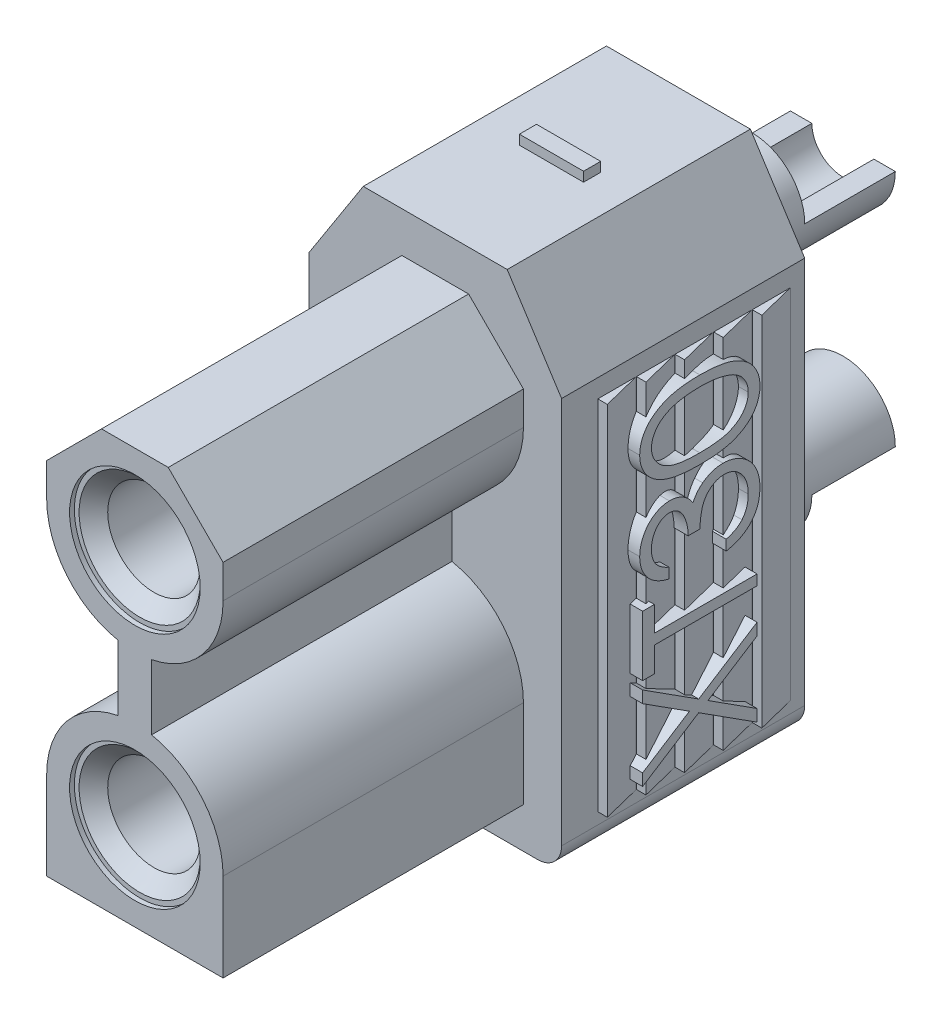
from build123d import *

# Parameters (mm, degrees)
BOSS_EXTRUDE2_DEPTH        = 5.1
BOSS_EXTRUDE3_START        = 1.45
BOSS_EXTRUDE3_DEPTH        = 3.65
BOSS_EXTRUDE4_START        = 1
BOSS_EXTRUDE4_DEPTH        = 7.5
BOSS_EXTRUDE5_DEPTH        = 5.1
BOSS_EXTRUDE5_DEPTH_BACK   = 3.45
SKETCH7_R                  = 1.1
BOSS_EXTRUDE5_2_DEPTH      = 5.1
BOSS_EXTRUDE5_2_DEPTH_BACK = 3.45
SKETCH8_R                  = 0.65
CUT_EXTRUDE1_DEPTH         = 3
CUT_EXTRUDE2_DEPTH         = 13.156309846
CUT_EXTRUDE2_DEPTH_BACK    = 13.156309846
SKETCH9_W                  = 1.9
SKETCH9_H                  = 1.1
SKETCH9_W_2                = 1.75
CHAMFER1_SIZE              = 0.65
CHAMFER3_SIZE              = 0.65
SKETCH10_R                 = 1.37
SKETCH10_R_2               = 0.97
BOSS_EXTRUDE6_DEPTH        = 6.2
BOSS_EXTRUDE6_2_DEPTH      = 6.2
BOSS_EXTRUDE7_DEPTH        = 0.2
SKETCH13_W                 = 1.346153847
SKETCH13_H                 = 0.358974359
BOSS_EXTRUDE8_DEPTH        = 0.2
BOSS_EXTRUDE9_DEPTH        = 0.3
BOSS_EXTRUDE10_DEPTH       = 0.3
CHAMFER4_SIZE              = 0.3
CHAMFER5_SIZE              = 0.3
SKETCH17_R                 = 1.37
BOSS_EXTRUDE11_DEPTH       = 6.3
BOSS_EXTRUDE11_2_DEPTH     = 6.3
SKETCH18_W                 = 0.7
SKETCH18_H                 = 1.720139453
BOSS_EXTRUDE12_DEPTH       = 6.3


with BuildPart() as part:
    # Sketch3 → Boss-Extrude2 (new body)
    with BuildSketch(Plane.XY):
        with BuildLine():
            Line((2.15, 0.260364397), (-2.15, 0.260364397))
            ThreePointArc((-2.15, 0.260364397), (-2.503553391, 0.406811006), (-2.65, 0.760364397))
            Line((-2.65, 0.760364397), (-2.65, 8.886196367))
            Line((-2.65, 8.886196367), (-1.509463409, 10.660364397))
            Line((-1.509463409, 10.660364397), (1.509463409, 10.660364397))
            Line((1.509463409, 10.660364397), (2.65, 8.886196367))
            Line((2.65, 8.886196367), (2.65, 0.760364397))
            ThreePointArc((2.65, 0.760364397), (2.503553391, 0.406811006), (2.15, 0.260364397))
        make_face()
        Polygon((1.9, 1.010364397), (-1.9, 1.010364397), (-1.9, 8.665919952), (-1.1, 9.910364397), (1.1, 9.910364397), (1.9, 8.665919952), align=None, mode=Mode.SUBTRACT)
    extrude(amount=BOSS_EXTRUDE2_DEPTH)

    # Sketch4 → Boss-Extrude3 (add)
    with BuildSketch(Plane.XY.offset(BOSS_EXTRUDE3_START)):
        with BuildLine():
            Line((-1.5, 10.010364397), (1.4, 10.010364397))
            ThreePointArc((1.4, 10.010364397), (1.753553391, 9.863917787), (1.9, 9.510364397))
            Line((1.9, 9.510364397), (1.9, 1.010364397))
            Line((1.9, 1.010364397), (-2, 1.010364397))
            Line((-2, 1.010364397), (-2, 9.510364397))
            ThreePointArc((-2, 9.510364397), (-1.853553391, 9.863917787), (-1.5, 10.010364397))
        make_face()
    extrude(amount=BOSS_EXTRUDE3_DEPTH)

    # Sketch6 → Boss-Extrude4 (add)
    with BuildSketch(Plane(origin=(0, 0, 0), x_dir=(1, 0, 0), z_dir=(0, 1, 0)).offset(BOSS_EXTRUDE4_START)):
        Polygon((2.65, -0.3), (2.65, -1.1), (2.85, -1.1), align=None)
        Polygon((2.65, -1.11), (2.65, -1.91), (2.85, -1.91), align=None)
        Polygon((2.65, -1.92), (2.65, -2.72), (2.85, -2.72), align=None)
        Polygon((2.65, -2.73), (2.65, -3.53), (2.85, -3.53), align=None)
        Polygon((2.65, -3.54), (2.65, -4.34), (2.85, -4.34), align=None)
        Polygon((-2.85, -4.34), (-2.65, -3.54), (-2.65, -4.34), align=None)
        Polygon((-2.85, -3.53), (-2.65, -2.73), (-2.65, -3.53), align=None)
        Polygon((-2.85, -2.72), (-2.65, -1.92), (-2.65, -2.72), align=None)
        Polygon((-2.85, -1.91), (-2.65, -1.11), (-2.65, -1.91), align=None)
        Polygon((-2.85, -1.1), (-2.65, -0.3), (-2.65, -1.1), align=None)
    extrude(amount=BOSS_EXTRUDE4_DEPTH)

    # Sketch12 → Boss-Extrude7 (add)
    with BuildSketch(Plane.XZ.offset(-0.260364397)):
        Polygon((-0.148717949, 2.884615385), (-0.148717949, 3.916666667), (0.165384615, 3.916666667), (0.165384615, 2.884615385), (1.197435897, 2.884615385), (1.197435897, 2.570512821), (0.165384615, 2.570512821), (0.165384615, 1.538461538), (-0.148717949, 1.538461538), (-0.148717949, 2.570512821), (-1.180769231, 2.570512821), (-1.180769231, 2.884615385), align=None)
    extrude(amount=BOSS_EXTRUDE7_DEPTH)

    # Sketch13 → Boss-Extrude8 (add)
    with BuildSketch(Plane(origin=(0, 10.660364397, 0), x_dir=(-1, 0, 0), z_dir=(0, 1, 0))):
        with Locations((-0.052168047, 2.534824587)):
            Rectangle(SKETCH13_W, SKETCH13_H)
    extrude(amount=BOSS_EXTRUDE8_DEPTH)

    # Sketch14 → Boss-Extrude9 (add)
    # profile 1 of 4: a face of its own
    with BuildSketch(Plane.ZY.offset(2.65)):
        Polygon((3.7, 8.211538462), (3.7, 7.962980769), (2.718269231, 7.334615385), (3.7, 6.70625), (3.7, 6.457692308), (2.524038462, 7.210096154), (1.3, 6.426923077), (1.3, 6.675480769), (2.329807692, 7.334615385), (1.3, 7.99375), (1.3, 8.242307692), (2.524038462, 7.458653846), align=None)
    # profile 2 of 4: a face of its own
    with BuildSketch(Plane.ZY.offset(2.65)):
        Polygon((3.453846154, 6.288461538), (3.7, 6.288461538), (3.7, 5.026923077), (3.453846154, 5.026923077), (3.453846154, 5.55), (1.3, 5.55), (1.3, 5.765384615), (3.453846154, 5.765384615), align=None)
    # profile 3 of 4: a face of its own
    with BuildSketch(Plane.ZY.offset(2.65)):
        with BuildLine():
            Line((3.146153846, 4.503846154), (3.146153846, 4.719230769))
            add(Edge.make_bspline(
                [(3.146153846, 4.719230769), (3.170313264, 4.713395649), (3.217542949, 4.701988466), (3.285022214, 4.678195844), (3.348878343, 4.652276354), (3.40791565, 4.621152397), (3.463320612, 4.587203537), (3.513836583, 4.548307957), (3.560748331, 4.506260147), (3.602380265, 4.45975161), (3.64007928, 4.410977671), (3.672222176, 4.359251074), (3.699873024, 4.305612519), (3.722652611, 4.24969037), (3.73981297, 4.191318138), (3.752263351, 4.131023539), (3.760348687, 4.068648568), (3.761137781, 4.026307363), (3.761538462, 4.004807692)],
                knots=[0, 0, 0, 0, 1.162005537, 2.271625781, 3.343758855, 4.383309926, 5.390229558, 6.379919256, 7.361854164, 8.333198761, 9.295911338, 10.242430842, 11.177959212, 12.116337295, 13.062827104, 14.020064771, 14.994644689, 16, 16, 16, 16], degree=3))
            add(Edge.make_bspline(
                [(3.761538462, 4.004807692), (3.760592704, 3.973482383), (3.758721818, 3.911515062), (3.741637633, 3.820477544), (3.714603256, 3.732687725), (3.677249843, 3.649106526), (3.631178543, 3.57147103), (3.57634558, 3.502394787), (3.513808916, 3.442814094), (3.444735158, 3.392829378), (3.370914237, 3.353692236), (3.294936987, 3.324833008), (3.216983635, 3.307263856), (3.164350072, 3.304986903), (3.137980769, 3.303846154)],
                knots=[0, 0, 0, 0, 1.083050992, 2.142477498, 3.193116406, 4.255571735, 5.30263384, 6.308962982, 7.297363603, 8.282367274, 9.249857812, 10.179914175, 11.08814088, 12, 12, 12, 12], degree=3))
            add(Edge.make_bspline(
                [(3.137980769, 3.303846154), (3.112604681, 3.304644045), (3.062947616, 3.306205394), (2.990452875, 3.319462792), (2.922127206, 3.341773372), (2.85768298, 3.372678352), (2.797528805, 3.412683987), (2.741529337, 3.461145264), (2.689436199, 3.518404233), (2.659594275, 3.561795504), (2.644230769, 3.584134615)],
                knots=[0, 0, 0, 0, 1.024540389, 2.004866551, 2.965041327, 3.920577974, 4.882998113, 5.874504559, 6.905732034, 8, 8, 8, 8], degree=3))
            add(Edge.make_bspline(
                [(2.644230769, 3.584134615), (2.63190288, 3.558604269), (2.607477766, 3.50802127), (2.559576676, 3.439072335), (2.504269466, 3.376481792), (2.46110879, 3.341576385), (2.439423077, 3.324038462)],
                knots=[0, 0, 0, 0, 1.015518401, 2.012035669, 3.001164323, 4, 4, 4, 4], degree=3))
            add(Edge.make_bspline(
                [(2.439423077, 3.324038462), (2.423613732, 3.312485412), (2.392253932, 3.289568501), (2.341804337, 3.261361383), (2.290962579, 3.235479451), (2.237729623, 3.216431099), (2.183815408, 3.199993125), (2.128065414, 3.189177486), (2.071009313, 3.182234278), (2.032392143, 3.18125931), (2.012980769, 3.180769231)],
                knots=[0, 0, 0, 0, 1.02516404, 2.033540309, 3.025129118, 4.011046665, 4.991655828, 5.976607087, 6.982917762, 8, 8, 8, 8], degree=3))
            add(Edge.make_bspline(
                [(2.012980769, 3.180769231), (1.97937544, 3.182002464), (1.912322928, 3.184463127), (1.813234502, 3.206368134), (1.716541423, 3.240522701), (1.623676369, 3.288177011), (1.536970145, 3.347137911), (1.45974361, 3.417672544), (1.39291464, 3.498066224), (1.33725751, 3.587792791), (1.292734208, 3.684961717), (1.261839895, 3.788901588), (1.241716319, 3.898100993), (1.239558549, 3.972986084), (1.238461538, 4.011057692)],
                knots=[0, 0, 0, 0, 0.95570045, 1.906903359, 2.87519758, 3.868912786, 4.869932978, 5.851730567, 6.836639976, 7.83677598, 8.849487602, 9.869908895, 10.917060885, 12, 12, 12, 12], degree=3))
            add(Edge.make_bspline(
                [(1.238461538, 4.011057692), (1.239056885, 4.036716641), (1.240228328, 4.087204896), (1.248236511, 4.161429009), (1.262862801, 4.232278174), (1.282545067, 4.299848184), (1.307499405, 4.364199066), (1.338575083, 4.425134453), (1.375131542, 4.483029237), (1.417600288, 4.537337089), (1.465107492, 4.588051536), (1.518496527, 4.633824832), (1.576780462, 4.675420119), (1.640636272, 4.711723643), (1.709238734, 4.744388981), (1.783466275, 4.771255923), (1.862655319, 4.79490317), (1.917840055, 4.805897546), (1.946153846, 4.811538462)],
                knots=[0, 0, 0, 0, 1.048658725, 2.063410685, 3.046034179, 4.001477787, 4.936774919, 5.862367409, 6.792675028, 7.730719943, 8.675894397, 9.627829632, 10.600096036, 11.597688215, 12.626045268, 13.701542398, 14.82072376, 16, 16, 16, 16], degree=3))
            Line((1.946153846, 4.811538462), (1.946153846, 4.596153846))
            add(Edge.make_bspline(
                [(1.946153846, 4.596153846), (1.927674523, 4.590542446), (1.891730634, 4.579627786), (1.840000138, 4.561048839), (1.792577473, 4.539882024), (1.749114761, 4.517174898), (1.709183971, 4.493326821), (1.673840975, 4.466642301), (1.641533408, 4.439097744), (1.623331388, 4.418334759), (1.614423077, 4.408173077)],
                knots=[0, 0, 0, 0, 1.198163088, 2.33053128, 3.407730985, 4.417276592, 5.372219308, 6.28897303, 7.162600585, 8, 8, 8, 8], degree=3))
            add(Edge.make_bspline(
                [(1.614423077, 4.408173077), (1.604063077, 4.394735424), (1.583375055, 4.367901598), (1.556973938, 4.324174811), (1.534097806, 4.278187461), (1.516623272, 4.228943113), (1.501827162, 4.177504413), (1.49214452, 4.123039934), (1.485501203, 4.066030185), (1.484914964, 4.027103719), (1.484615385, 4.007211538)],
                knots=[0, 0, 0, 0, 0.946170439, 1.889420265, 2.845303464, 3.807233317, 4.801018734, 5.828864929, 6.890507805, 8, 8, 8, 8], degree=3))
            add(Edge.make_bspline(
                [(1.484615385, 4.007211538), (1.485037033, 3.98475169), (1.485861529, 3.940833395), (1.493465896, 3.87675431), (1.504492464, 3.815774027), (1.521740161, 3.758514848), (1.542431622, 3.704197617), (1.569520542, 3.654034852), (1.600113099, 3.606551829), (1.635698125, 3.563139581), (1.674161687, 3.524001317), (1.714968099, 3.490181532), (1.756852096, 3.460889731), (1.800790747, 3.437344011), (1.846353049, 3.418718241), (1.893709543, 3.406046248), (1.942461457, 3.397233195), (1.975601388, 3.396515597), (1.992307692, 3.396153846)],
                knots=[0, 0, 0, 0, 1.216990249, 2.379719373, 3.493992396, 4.571561497, 5.616923107, 6.638958652, 7.655775068, 8.674704564, 9.676001865, 10.625896028, 11.54399481, 12.441854662, 13.322657739, 14.20572845, 15.095482574, 16, 16, 16, 16], degree=3))
            add(Edge.make_bspline(
                [(1.992307692, 3.396153846), (2.014669779, 3.397203177), (2.05928268, 3.399296618), (2.12491721, 3.415279923), (2.188157598, 3.441568341), (2.247915784, 3.478376614), (2.303327092, 3.523161948), (2.352574163, 3.575490823), (2.393618756, 3.635491603), (2.421872315, 3.691070581), (2.440702124, 3.740419384), (2.453905233, 3.782567182), (2.464459565, 3.829794668), (2.474668782, 3.881534884), (2.483227542, 3.938006046), (2.490395838, 3.99925903), (2.496122592, 4.065318479), (2.498681403, 4.111049473), (2.5, 4.134615385)],
                knots=[0, 0, 0, 0, 1.070481957, 2.135637345, 3.216366529, 4.339485895, 5.485746587, 6.620975969, 7.768829582, 8.956804399, 9.598399438, 10.297751078, 11.070570279, 11.915248466, 12.824061284, 13.805856426, 14.869322739, 16, 16, 16, 16], degree=3))
            Line((2.5, 4.134615385), (2.746153846, 4.134615385))
            add(Edge.make_bspline(
                [(2.746153846, 4.134615385), (2.746659909, 4.104923977), (2.74765116, 4.046765804), (2.759557156, 3.961798157), (2.776212077, 3.880451678), (2.801133952, 3.804583191), (2.831047314, 3.735657242), (2.864776815, 3.675530146), (2.902990827, 3.62562689), (2.945187826, 3.585822797), (2.990973089, 3.556608006), (3.038193773, 3.534679412), (3.087948546, 3.521823981), (3.121884535, 3.520098217), (3.138942308, 3.519230769)],
                knots=[0, 0, 0, 0, 1.321708579, 2.588902423, 3.815526512, 5.016621128, 6.138757764, 7.158873101, 8.079948563, 8.928590313, 9.728601868, 10.489025425, 11.240515403, 12, 12, 12, 12], degree=3))
            add(Edge.make_bspline(
                [(3.138942308, 3.519230769), (3.151475649, 3.519514904), (3.176410136, 3.520080176), (3.212838313, 3.527210223), (3.248154898, 3.537922039), (3.282199645, 3.552657938), (3.314774944, 3.572345731), (3.345920757, 3.59597764), (3.376159056, 3.623565073), (3.404043204, 3.655829025), (3.430345097, 3.690758195), (3.453082104, 3.728681243), (3.472353977, 3.768761731), (3.488276651, 3.811036515), (3.500246646, 3.855674947), (3.508843236, 3.902458453), (3.514217465, 3.951478695), (3.514991259, 3.984922153), (3.515384615, 4.001923077)],
                knots=[0, 0, 0, 0, 0.884317272, 1.759307272, 2.611736065, 3.488921043, 4.37244062, 5.294096728, 6.247679003, 7.258495569, 8.302441962, 9.333537773, 10.376747089, 11.440883505, 12.520330301, 13.637364711, 14.798958396, 16, 16, 16, 16], degree=3))
            add(Edge.make_bspline(
                [(3.515384615, 4.001923077), (3.514432389, 4.029250838), (3.51257247, 4.082628311), (3.496224619, 4.159563101), (3.470323134, 4.231010572), (3.439047168, 4.285439132), (3.408279997, 4.325699299), (3.381810999, 4.355020423), (3.351800577, 4.383288989), (3.317425578, 4.409395714), (3.27986802, 4.434904968), (3.238921049, 4.459573177), (3.194000885, 4.482607996), (3.162411731, 4.496629667), (3.146153846, 4.503846154)],
                knots=[0, 0, 0, 0, 1.4727372, 2.876598283, 4.222346151, 5.558423782, 6.24313385, 6.953189256, 7.68715613, 8.463578749, 9.278833271, 10.135787152, 11.040551781, 12, 12, 12, 12], degree=3))
        make_face()
    # profile 4 of 4: a face of its own
    with BuildSketch(Plane.ZY.offset(2.65)):
        with BuildLine():
            add(Edge.make_bspline(
                [(2.499038462, 2.965384615), (2.537505242, 2.965159689), (2.612227517, 2.964722765), (2.721108414, 2.959862134), (2.823252613, 2.951787614), (2.918664999, 2.940721985), (3.007370214, 2.927255947), (3.089131173, 2.909279594), (3.164326392, 2.888836595), (3.233200736, 2.865143267), (3.296683291, 2.838409551), (3.355943811, 2.809309064), (3.410907058, 2.776702805), (3.462398728, 2.742398603), (3.509844149, 2.705142892), (3.553153471, 2.665328627), (3.592352846, 2.622560867), (3.627908811, 2.577685461), (3.658882589, 2.530418809), (3.686792023, 2.482217984), (3.709699001, 2.432232443), (3.728521186, 2.380918072), (3.743602926, 2.328424096), (3.754047002, 2.274533615), (3.760592629, 2.219233611), (3.761220193, 2.181909617), (3.761538462, 2.162980769)],
                knots=[0, 0, 0, 0, 1.646377244, 3.198111528, 4.663803227, 6.031090796, 7.308794487, 8.502186765, 9.612154809, 10.642545331, 11.617106989, 12.558866172, 13.465886467, 14.35053239, 15.20542558, 16.045215227, 16.865619885, 17.686225247, 18.492864914, 19.282407821, 20.068097601, 20.842842034, 21.620163247, 22.403093475, 23.190129512, 24, 24, 24, 24], degree=3))
            add(Edge.make_bspline(
                [(3.761538462, 2.162980769), (3.76120396, 2.143893584), (3.760538741, 2.105935178), (3.75414518, 2.049816063), (3.74353641, 1.994993425), (3.728504885, 1.941700987), (3.709856421, 1.889500996), (3.686482397, 1.838801745), (3.659274031, 1.789288317), (3.627303373, 1.741747549), (3.591658383, 1.695657527), (3.551363982, 1.652150352), (3.506827031, 1.611222065), (3.458524039, 1.572358998), (3.405528552, 1.536663732), (3.348762306, 1.502670521), (3.28723257, 1.472243982), (3.221965963, 1.442940205), (3.151156597, 1.417646271), (3.075203618, 1.394835131), (2.99320989, 1.376403839), (2.905605608, 1.361051195), (2.812069048, 1.349157552), (2.712800717, 1.340495169), (2.607735307, 1.335919339), (2.535901353, 1.335057601), (2.499038462, 1.334615385)],
                knots=[0, 0, 0, 0, 0.810914788, 1.612654377, 2.396697861, 3.181598691, 3.963628158, 4.749916497, 5.551656086, 6.361998678, 7.18212741, 8.025565596, 8.878627764, 9.750805457, 10.657531673, 11.591944965, 12.560506719, 13.57287815, 14.630710178, 15.753379473, 16.941251878, 18.199788006, 19.531962791, 20.947069417, 22.433333509, 24, 24, 24, 24], degree=3))
            add(Edge.make_bspline(
                [(2.499038462, 1.334615385), (2.46233649, 1.335062738), (2.390824197, 1.335934387), (2.286229632, 1.340437871), (2.187494777, 1.349350593), (2.094344793, 1.360374224), (2.00733274, 1.376077235), (1.925631239, 1.393928791), (1.849945361, 1.416116359), (1.779509438, 1.441065535), (1.714562595, 1.46973345), (1.653564755, 1.500428903), (1.596844827, 1.534213456), (1.543850111, 1.570121601), (1.495128206, 1.608654337), (1.450558698, 1.649755931), (1.410170985, 1.69345767), (1.374038974, 1.739651897), (1.342440476, 1.787940548), (1.314196501, 1.837288706), (1.291278267, 1.888681315), (1.271927958, 1.940976215), (1.256861852, 1.994666843), (1.246546191, 2.049700536), (1.239291373, 2.105897061), (1.238739108, 2.14388698), (1.238461538, 2.162980769)],
                knots=[0, 0, 0, 0, 1.56130642, 3.042141888, 4.451772327, 5.777565838, 7.030558081, 8.211376819, 9.333164717, 10.383253789, 11.387583522, 12.350962576, 13.286244149, 14.193812918, 15.072134482, 15.925989337, 16.770211267, 17.600669898, 18.417446232, 19.22325363, 20.01647746, 20.807971184, 21.593601364, 22.38506573, 23.188331689, 24, 24, 24, 24], degree=3))
            add(Edge.make_bspline(
                [(1.238461538, 2.162980769), (1.23878287, 2.181908848), (1.239416472, 2.219231325), (1.245917863, 2.274542438), (1.25651944, 2.328348871), (1.270916329, 2.380758187), (1.289213921, 2.431877644), (1.31248778, 2.481206477), (1.339481837, 2.529396148), (1.370192627, 2.576226767), (1.405386394, 2.620805771), (1.444309654, 2.663388571), (1.487938683, 2.702899968), (1.535575131, 2.739688746), (1.586814803, 2.7745993), (1.642162448, 2.806886042), (1.701978203, 2.835929766), (1.765811202, 2.863262607), (1.835191738, 2.887356454), (1.910788018, 2.908478489), (1.993018222, 2.926086659), (2.081638235, 2.940247241), (2.176714385, 2.951921216), (2.278414071, 2.9598239), (2.38664955, 2.964726636), (2.460891856, 2.965161287), (2.499038462, 2.965384615)],
                knots=[0, 0, 0, 0, 0.810940842, 1.599017053, 2.38298203, 3.159479784, 3.926441347, 4.70693857, 5.494146311, 6.292334103, 7.104379492, 7.925868426, 8.762126819, 9.623561095, 10.503686106, 11.41783325, 12.366995289, 13.351843594, 14.392337808, 15.512229747, 16.713911458, 17.994391108, 19.357476964, 20.818259213, 22.365182633, 24, 24, 24, 24], degree=3))
        make_face()
        with BuildLine():
            add(Edge.make_bspline(
                [(2.5, 2.75), (2.467943749, 2.749918093), (2.405728861, 2.749759129), (2.315322054, 2.745606306), (2.230999542, 2.739949004), (2.152654262, 2.732652113), (2.080551391, 2.721815812), (2.014195056, 2.709673993), (1.953936316, 2.69489823), (1.899362024, 2.677415701), (1.849544813, 2.657503965), (1.803192165, 2.635760049), (1.759742093, 2.612413867), (1.719635907, 2.586240321), (1.682474377, 2.557833083), (1.648364296, 2.527145508), (1.617454495, 2.494231565), (1.580777019, 2.448667879), (1.542427413, 2.388811558), (1.509443824, 2.313008014), (1.488581598, 2.235082492), (1.485935923, 2.182176334), (1.484615385, 2.155769231)],
                knots=[0, 0, 0, 0, 1.459116078, 2.831857795, 4.118796693, 5.306371758, 6.412361096, 7.436813035, 8.376339383, 9.234574298, 10.043323891, 10.816788787, 11.564361537, 12.286735248, 12.994408768, 13.691741332, 14.372975427, 15.047457468, 16.352811911, 17.594285292, 18.799233213, 20, 20, 20, 20], degree=3))
            add(Edge.make_bspline(
                [(1.484615385, 2.155769231), (1.485711006, 2.129192542), (1.487899986, 2.076094034), (1.50901912, 1.998516575), (1.540883947, 1.92320439), (1.578562237, 1.864183631), (1.61444452, 1.819281315), (1.645037421, 1.787109665), (1.679292873, 1.757581403), (1.71625239, 1.729575409), (1.756622094, 1.703889185), (1.80020786, 1.680531605), (1.847130725, 1.65921731), (1.879887117, 1.647073964), (1.896634615, 1.640865385)],
                knots=[0, 0, 0, 0, 1.353760809, 2.704726607, 4.075137775, 5.516104923, 6.260822281, 7.007110065, 7.778089737, 8.566572457, 9.372053459, 10.217411131, 11.088608312, 12, 12, 12, 12], degree=3))
            add(Edge.make_bspline(
                [(1.896634615, 1.640865385), (1.918049294, 1.633629887), (1.961530275, 1.618938723), (2.028979636, 1.600004935), (2.099747246, 1.585093804), (2.173410183, 1.571678925), (2.250511692, 1.562522543), (2.330813213, 1.555152614), (2.41437529, 1.550811572), (2.471148998, 1.550273457), (2.5, 1.55)],
                knots=[0, 0, 0, 0, 0.884706709, 1.796334032, 2.740027952, 3.714592787, 4.726048262, 5.777819803, 6.87074269, 8, 8, 8, 8], degree=3))
            add(Edge.make_bspline(
                [(2.5, 1.55), (2.528850382, 1.550301594), (2.585294877, 1.550891648), (2.667873225, 1.55476836), (2.746441917, 1.560997914), (2.821072227, 1.569429478), (2.891631323, 1.581004233), (2.958220173, 1.594904362), (3.020820825, 1.611200667), (3.079594722, 1.629893016), (3.134330614, 1.650959034), (3.185147673, 1.674230668), (3.2323153, 1.699064654), (3.275698105, 1.726043141), (3.315491909, 1.754839941), (3.350898473, 1.786216607), (3.383015255, 1.818928162), (3.419675301, 1.864745666), (3.45705475, 1.924728034), (3.491454128, 1.99936505), (3.511208386, 2.077036348), (3.513993543, 2.12954386), (3.515384615, 2.155769231)],
                knots=[0, 0, 0, 0, 1.313668642, 2.570134578, 3.763346207, 4.902004944, 5.98888779, 7.017888835, 7.998425394, 8.933058446, 9.82474457, 10.667209444, 11.476765193, 12.250262638, 12.991704352, 13.7104269, 14.401925311, 15.076585796, 16.378385137, 17.609787933, 18.806186071, 20, 20, 20, 20], degree=3))
            add(Edge.make_bspline(
                [(3.515384615, 2.155769231), (3.513993418, 2.182314751), (3.511208489, 2.235454152), (3.491505929, 2.313915865), (3.457375016, 2.389084556), (3.419433917, 2.448585691), (3.383664241, 2.494345387), (3.352558795, 2.526658121), (3.318345526, 2.556867163), (3.281341328, 2.585298067), (3.241214914, 2.611446417), (3.197771161, 2.634802154), (3.151414205, 2.656533589), (3.101608328, 2.676488074), (3.046951763, 2.693808585), (2.986997143, 2.709289928), (2.920578828, 2.72142438), (2.848274376, 2.732013417), (2.769832785, 2.740086958), (2.68531587, 2.745591783), (2.594752721, 2.749766643), (2.53221683, 2.749920656), (2.5, 2.75)],
                knots=[0, 0, 0, 0, 1.207964612, 2.418129846, 3.655795183, 4.951004962, 5.620895151, 6.296795572, 6.989224116, 7.696855977, 8.419187164, 9.166715907, 9.940135271, 10.748837255, 11.607021648, 12.548275234, 13.5654991, 14.678641405, 15.874140913, 17.15372626, 18.533675393, 20, 20, 20, 20], degree=3))
        make_face(mode=Mode.SUBTRACT)
    extrude(amount=BOSS_EXTRUDE9_DEPTH)

    # Sketch15 → Boss-Extrude10 (add)
    # profile 1 of 4: a face of its own
    with BuildSketch(Plane(origin=(2.65, 0, 0), x_dir=(0, 0, -1), z_dir=(1, 0, 0))):
        Polygon((-3.7, 1.288461538), (-3.7, 1.537019231), (-2.718269231, 2.165384615), (-3.7, 2.79375), (-3.7, 3.042307692), (-2.524038462, 2.289903846), (-1.3, 3.073076923), (-1.3, 2.824519231), (-2.329807692, 2.165384615), (-1.3, 1.50625), (-1.3, 1.257692308), (-2.524038462, 2.041346154), align=None)
    # profile 2 of 4: a face of its own
    with BuildSketch(Plane(origin=(2.65, 0, 0), x_dir=(0, 0, -1), z_dir=(1, 0, 0))):
        Polygon((-3.453846154, 3.211538462), (-3.7, 3.211538462), (-3.7, 4.473076923), (-3.453846154, 4.473076923), (-3.453846154, 3.95), (-1.3, 3.95), (-1.3, 3.734615385), (-3.453846154, 3.734615385), align=None)
    # profile 3 of 4: a face of its own
    with BuildSketch(Plane(origin=(2.65, 0, 0), x_dir=(0, 0, -1), z_dir=(1, 0, 0))):
        with BuildLine():
            Line((-3.146153846, 4.996153846), (-3.146153846, 4.780769231))
            add(Edge.make_bspline(
                [(-3.146153846, 4.780769231), (-3.170313264, 4.786604351), (-3.217542949, 4.798011534), (-3.285022214, 4.821804156), (-3.348878343, 4.847723646), (-3.40791565, 4.878847603), (-3.463320612, 4.912796463), (-3.513836583, 4.951692043), (-3.560748331, 4.993739853), (-3.602380265, 5.04024839), (-3.64007928, 5.089022329), (-3.672222176, 5.140748926), (-3.699873024, 5.194387481), (-3.722652611, 5.25030963), (-3.73981297, 5.308681862), (-3.752263351, 5.368976461), (-3.760348687, 5.431351432), (-3.761137781, 5.473692637), (-3.761538462, 5.495192308)],
                knots=[0, 0, 0, 0, 1.162005537, 2.271625781, 3.343758855, 4.383309926, 5.390229558, 6.379919256, 7.361854164, 8.333198761, 9.295911338, 10.242430842, 11.177959212, 12.116337295, 13.062827104, 14.020064771, 14.994644689, 16, 16, 16, 16], degree=3))
            add(Edge.make_bspline(
                [(-3.761538462, 5.495192308), (-3.760592704, 5.526517617), (-3.758721818, 5.588484938), (-3.741637633, 5.679522456), (-3.714603256, 5.767312275), (-3.677249843, 5.850893474), (-3.631178543, 5.92852897), (-3.57634558, 5.997605213), (-3.513808916, 6.057185906), (-3.444735158, 6.107170622), (-3.370914237, 6.146307764), (-3.294936987, 6.175166992), (-3.216983635, 6.192736144), (-3.164350072, 6.195013097), (-3.137980769, 6.196153846)],
                knots=[0, 0, 0, 0, 1.083050992, 2.142477498, 3.193116406, 4.255571735, 5.30263384, 6.308962982, 7.297363603, 8.282367274, 9.249857812, 10.179914175, 11.08814088, 12, 12, 12, 12], degree=3))
            add(Edge.make_bspline(
                [(-3.137980769, 6.196153846), (-3.112604681, 6.195355955), (-3.062947616, 6.193794606), (-2.990452875, 6.180537208), (-2.922127206, 6.158226628), (-2.85768298, 6.127321648), (-2.797528805, 6.087316013), (-2.741529337, 6.038854736), (-2.689436199, 5.981595767), (-2.659594275, 5.938204496), (-2.644230769, 5.915865385)],
                knots=[0, 0, 0, 0, 1.024540389, 2.004866551, 2.965041327, 3.920577974, 4.882998113, 5.874504559, 6.905732034, 8, 8, 8, 8], degree=3))
            add(Edge.make_bspline(
                [(-2.644230769, 5.915865385), (-2.631947571, 5.941428272), (-2.607571562, 5.992157828), (-2.559006904, 6.060606804), (-2.504311045, 6.12369148), (-2.461150573, 6.158459102), (-2.439423077, 6.175961538)],
                knots=[0, 0, 0, 0, 1.015663554, 2.015584519, 3.001021554, 4, 4, 4, 4], degree=3))
            add(Edge.make_bspline(
                [(-2.439423077, 6.175961538), (-2.423612047, 6.187509888), (-2.392248904, 6.210417473), (-2.341823927, 6.238693268), (-2.290840048, 6.264345232), (-2.237930741, 6.284333954), (-2.183709246, 6.299813177), (-2.12808246, 6.310877885), (-2.071004959, 6.317751581), (-2.032390687, 6.31873596), (-2.012980769, 6.319230769)],
                knots=[0, 0, 0, 0, 1.025084078, 2.033381695, 3.024893161, 4.013698104, 4.991890475, 5.976764909, 6.982997093, 8, 8, 8, 8], degree=3))
            add(Edge.make_bspline(
                [(-2.012980769, 6.319230769), (-1.979374275, 6.318000068), (-1.912319439, 6.315544458), (-1.813248482, 6.293601467), (-1.716418185, 6.259570588), (-1.623756647, 6.211297303), (-1.537142597, 6.152199607), (-1.459073945, 6.082668571), (-1.393021198, 6.001710161), (-1.337163761, 5.912258452), (-1.292929099, 5.814928886), (-1.261046363, 5.711252352), (-1.241923125, 5.601828841), (-1.239628538, 5.526999571), (-1.238461538, 5.488942308)],
                knots=[0, 0, 0, 0, 0.955697303, 1.906897079, 2.875188111, 3.870982192, 4.871999088, 5.854111427, 6.836107184, 7.836239895, 8.848948182, 9.870701427, 10.917064451, 12, 12, 12, 12], degree=3))
            add(Edge.make_bspline(
                [(-1.238461538, 5.488942308), (-1.239062077, 5.463284974), (-1.240243738, 5.412799897), (-1.248177969, 5.338552782), (-1.263063166, 5.267830621), (-1.281783363, 5.199946675), (-1.307666131, 5.135925478), (-1.338523186, 5.074846144), (-1.375145816, 5.016976404), (-1.41759561, 4.96265993), (-1.465111807, 4.91195475), (-1.518483783, 4.866152665), (-1.576715432, 4.824746924), (-1.640330558, 4.788000613), (-1.709150984, 4.755759082), (-1.783452485, 4.72871617), (-1.862659044, 4.705104367), (-1.917841318, 4.69410501), (-1.946153846, 4.688461538)],
                knots=[0, 0, 0, 0, 1.048603596, 2.063302207, 3.045874044, 3.999447474, 4.937100059, 5.862643889, 6.7929026, 7.7308982, 8.676022965, 9.627908155, 10.600123445, 11.591992905, 12.626222643, 13.701663232, 14.820785756, 16, 16, 16, 16], degree=3))
            Line((-1.946153846, 4.688461538), (-1.946153846, 4.903846154))
            add(Edge.make_bspline(
                [(-1.946153846, 4.903846154), (-1.927674523, 4.909457554), (-1.891730634, 4.920372214), (-1.840000138, 4.938951161), (-1.792577473, 4.960117976), (-1.749114761, 4.982825102), (-1.709183971, 5.006673179), (-1.673840975, 5.033357699), (-1.641533408, 5.060902256), (-1.623331388, 5.081665241), (-1.614423077, 5.091826923)],
                knots=[0, 0, 0, 0, 1.198163088, 2.33053128, 3.407730985, 4.417276592, 5.372219308, 6.28897303, 7.162600585, 8, 8, 8, 8], degree=3))
            add(Edge.make_bspline(
                [(-1.614423077, 5.091826923), (-1.604067348, 5.105266076), (-1.583387857, 5.1321029), (-1.556922628, 5.175807161), (-1.534269024, 5.221931471), (-1.515855225, 5.270860473), (-1.502033164, 5.322600731), (-1.492084694, 5.376942365), (-1.485517159, 5.433974536), (-1.48492036, 5.472897878), (-1.484615385, 5.492788462)],
                knots=[0, 0, 0, 0, 0.946083416, 1.889246487, 2.84504177, 3.809995578, 4.801312957, 5.829064617, 6.89060985, 8, 8, 8, 8], degree=3))
            add(Edge.make_bspline(
                [(-1.484615385, 5.492788462), (-1.48503772, 5.515248006), (-1.485863559, 5.559165707), (-1.49345833, 5.623249039), (-1.504519185, 5.684214146), (-1.521602373, 5.741384152), (-1.542709242, 5.795507929), (-1.569211006, 5.845826774), (-1.60030453, 5.893001247), (-1.635645667, 5.936427125), (-1.674334692, 5.975475473), (-1.714800798, 6.009856853), (-1.756873367, 6.039085193), (-1.800785221, 6.062662504), (-1.846354521, 6.081280024), (-1.893709147, 6.093954218), (-1.942461558, 6.102766686), (-1.975601422, 6.103484363), (-1.992307692, 6.103846154)],
                knots=[0, 0, 0, 0, 1.217147791, 2.380027433, 3.494444702, 4.572153297, 5.609568379, 6.639424714, 7.649109417, 8.668170816, 9.669597737, 10.625200337, 11.543417969, 12.441394052, 13.322311151, 14.205496177, 15.095365482, 16, 16, 16, 16], degree=3))
            add(Edge.make_bspline(
                [(-1.992307692, 6.103846154), (-2.014668323, 6.102794596), (-2.059278321, 6.100696713), (-2.124934651, 6.084746761), (-2.18821688, 6.058275185), (-2.248305389, 6.021942445), (-2.303316966, 5.976632765), (-2.352751361, 5.924488333), (-2.39350346, 5.864090554), (-2.421685413, 5.808542998), (-2.440909842, 5.759331314), (-2.453715767, 5.717218212), (-2.464559344, 5.670070734), (-2.474647781, 5.618459552), (-2.483233842, 5.561995623), (-2.490393946, 5.500740468), (-2.496123116, 5.43468166), (-2.498681582, 5.388950575), (-2.5, 5.365384615)],
                knots=[0, 0, 0, 0, 1.070505987, 2.135685285, 3.216438728, 4.346150463, 5.486482244, 6.621737109, 7.7759408, 8.963942283, 9.59839197, 10.305095457, 11.070459627, 11.915156775, 12.823989992, 13.805807174, 14.869297358, 16, 16, 16, 16], degree=3))
            Line((-2.5, 5.365384615), (-2.746153846, 5.365384615))
            add(Edge.make_bspline(
                [(-2.746153846, 5.365384615), (-2.746730338, 5.395066113), (-2.747859148, 5.453184545), (-2.758772232, 5.538305504), (-2.776292024, 5.619355998), (-2.801324781, 5.695170906), (-2.830810345, 5.764140042), (-2.864880102, 5.82421666), (-2.903441563, 5.873819218), (-2.945756429, 5.913465928), (-2.990892973, 5.943600213), (-3.038225163, 5.96527192), (-3.08794064, 5.978188277), (-3.12188189, 5.979905883), (-3.138942308, 5.980769231)],
                knots=[0, 0, 0, 0, 1.322091412, 2.58874672, 3.817242262, 5.011895168, 6.140903042, 7.155122731, 8.080855046, 8.929742606, 9.727943956, 10.488587771, 11.240295418, 12, 12, 12, 12], degree=3))
            add(Edge.make_bspline(
                [(-3.138942308, 5.980769231), (-3.151477704, 5.980491282), (-3.176416281, 5.979938317), (-3.212965293, 5.972687545), (-3.248395398, 5.962292795), (-3.282302632, 5.947200869), (-3.314756392, 5.927646943), (-3.346112693, 5.904061066), (-3.375966368, 5.875771032), (-3.404471434, 5.844085888), (-3.430403155, 5.809000096), (-3.453097703, 5.771332087), (-3.472349685, 5.731234601), (-3.488277828, 5.68896449), (-3.500246317, 5.644324772), (-3.508843329, 5.597541626), (-3.514217441, 5.548521284), (-3.514991251, 5.51507784), (-3.515384615, 5.498076923)],
                knots=[0, 0, 0, 0, 0.884325644, 1.759323928, 2.622595547, 3.489424008, 4.37295195, 5.294616785, 6.255907374, 7.274251867, 8.302369084, 9.333474657, 10.37669385, 11.44084034, 12.520297356, 13.637342342, 14.798947025, 16, 16, 16, 16], degree=3))
            add(Edge.make_bspline(
                [(-3.515384615, 5.498076923), (-3.514430539, 5.470750065), (-3.512567005, 5.417374355), (-3.496244938, 5.340426984), (-3.470202824, 5.268893726), (-3.439117325, 5.214215783), (-3.408431313, 5.173839161), (-3.381631962, 5.144986404), (-3.351849455, 5.116652339), (-3.317249426, 5.090701018), (-3.280175056, 5.064456005), (-3.238741674, 5.040562592), (-3.194030089, 5.017344517), (-3.162421654, 5.003354197), (-3.146153846, 4.996153846)],
                knots=[0, 0, 0, 0, 1.472543308, 2.876219568, 4.221790263, 5.565193594, 6.249813518, 6.953379497, 7.687249741, 8.463570142, 9.283606569, 10.136032583, 11.040678096, 12, 12, 12, 12], degree=3))
        make_face()
    # profile 4 of 4: a face of its own
    with BuildSketch(Plane(origin=(2.65, 0, 0), x_dir=(0, 0, -1), z_dir=(1, 0, 0))):
        with BuildLine():
            add(Edge.make_bspline(
                [(-2.499038462, 6.534615385), (-2.537505242, 6.534840311), (-2.612227517, 6.535277235), (-2.721108414, 6.540137866), (-2.823252612, 6.548212387), (-2.918665, 6.559278014), (-3.007370212, 6.572744056), (-3.089131182, 6.590720395), (-3.16432636, 6.611163442), (-3.233200844, 6.634856607), (-3.296682915, 6.661590889), (-3.355945145, 6.690689379), (-3.410902324, 6.723302714), (-3.46241569, 6.757581622), (-3.50969849, 6.794860577), (-3.55329551, 6.834340247), (-3.59283909, 6.876810232), (-3.628356308, 6.921858611), (-3.659499726, 6.96918007), (-3.687100855, 7.017481491), (-3.709835759, 7.067625914), (-3.728433536, 7.118953214), (-3.74361533, 7.17157157), (-3.754043667, 7.22546755), (-3.760593493, 7.280766088), (-3.761220484, 7.318090281), (-3.761538462, 7.337019231)],
                knots=[0, 0, 0, 0, 1.646148282, 3.197666765, 4.66315463, 6.030252048, 7.307778049, 8.501004361, 9.610818041, 10.641065266, 11.615491391, 12.557119604, 13.464013759, 14.348536654, 15.203310953, 16.038349431, 16.863300206, 17.683791446, 18.490318933, 19.285717724, 20.06220424, 20.843281102, 21.620494212, 22.403315558, 23.190242141, 24, 24, 24, 24], degree=3))
            add(Edge.make_bspline(
                [(-3.761538462, 7.337019231), (-3.761273604, 7.356115673), (-3.760746632, 7.394110871), (-3.753329179, 7.450082401), (-3.743755258, 7.505079003), (-3.728400265, 7.558266269), (-3.710026025, 7.610649868), (-3.685781507, 7.660927126), (-3.659413711, 7.710873095), (-3.627247217, 7.758218797), (-3.591697949, 7.804378834), (-3.551340441, 7.84764905), (-3.507291591, 7.889135547), (-3.458568983, 7.927271395), (-3.405919678, 7.963691045), (-3.348902322, 7.997011969), (-3.287643275, 8.027927182), (-3.222426524, 8.057017809), (-3.151510029, 8.082456793), (-3.075336115, 8.105074084), (-2.99321499, 8.12361278), (-2.90560412, 8.138943957), (-2.812069484, 8.150843868), (-2.712800592, 8.159504422), (-2.607735341, 8.164080772), (-2.535901364, 8.164942437), (-2.499038462, 8.165384615)],
                knots=[0, 0, 0, 0, 0.810910589, 1.61342667, 2.396193133, 3.181089899, 3.963115317, 4.752255436, 5.550715454, 6.36105385, 7.181178335, 8.024612154, 8.872680183, 9.750181803, 10.651284446, 11.591556747, 12.554036451, 13.566402641, 14.62422919, 15.753422176, 16.94128843, 18.199818041, 19.531985927, 20.947085226, 22.433341622, 24, 24, 24, 24], degree=3))
            add(Edge.make_bspline(
                [(-2.499038462, 8.165384615), (-2.462336675, 8.164932708), (-2.390664663, 8.164050215), (-2.286067227, 8.159602572), (-2.187333416, 8.15063233), (-2.094357965, 8.139575379), (-2.007097768, 8.124072848), (-1.925609682, 8.105393579), (-1.849605204, 8.084111331), (-1.779628894, 8.058281927), (-1.714525314, 8.029868408), (-1.653716701, 7.99898637), (-1.596714403, 7.965853481), (-1.543926227, 7.929980041), (-1.495399183, 7.891216897), (-1.451199254, 7.849759479), (-1.410585056, 7.806111463), (-1.37464414, 7.75968232), (-1.342232747, 7.711895622), (-1.314908078, 7.661944579), (-1.291232856, 7.611107572), (-1.271876178, 7.558877043), (-1.256864848, 7.505333632), (-1.246545376, 7.450299335), (-1.23929158, 7.394102972), (-1.238739177, 7.356113031), (-1.238461538, 7.337019231)],
                knots=[0, 0, 0, 0, 1.561645053, 3.049612875, 4.452756685, 5.778837748, 7.032101753, 8.221335837, 9.334924186, 10.387562255, 11.392109817, 12.355697819, 13.287721948, 14.19548756, 15.068665045, 15.927346723, 16.771751757, 17.602390507, 18.423119567, 19.225778204, 20.022010933, 20.807278863, 21.593079439, 22.384715467, 23.188155646, 24, 24, 24, 24], degree=3))
            add(Edge.make_bspline(
                [(-1.238461538, 7.337019231), (-1.238781325, 7.318090695), (-1.239411882, 7.280767319), (-1.245935583, 7.225462798), (-1.256423929, 7.171783409), (-1.271109599, 7.119464261), (-1.289085492, 7.068236945), (-1.31250514, 7.01879946), (-1.339477152, 6.970602308), (-1.370193712, 6.923773367), (-1.405386871, 6.8791953), (-1.444306581, 6.836606923), (-1.487950875, 6.797117517), (-1.53563262, 6.760161804), (-1.587222629, 6.725520507), (-1.642755524, 6.693188994), (-1.702326128, 6.663480286), (-1.766309902, 6.636289253), (-1.835673227, 6.612181369), (-1.911060084, 6.590968785), (-1.993236179, 6.574026946), (-2.081784288, 6.559666118), (-2.176884334, 6.548158598), (-2.278570723, 6.540141219), (-2.38665036, 6.535280925), (-2.460892131, 6.53484128), (-2.499038462, 6.534615385)],
                knots=[0, 0, 0, 0, 0.810927267, 1.598990287, 2.382942141, 3.152806972, 3.926217614, 4.706701772, 5.493896336, 6.292070767, 7.104102563, 7.925577746, 8.761822141, 9.623241997, 10.509042271, 11.423174113, 12.375371989, 13.360203808, 14.400680605, 15.520553799, 16.714061498, 17.994519714, 19.364400916, 20.818312473, 22.365209998, 24, 24, 24, 24], degree=3))
        make_face()
        with BuildLine():
            add(Edge.make_bspline(
                [(-2.5, 6.75), (-2.467943878, 6.750083703), (-2.405729238, 6.750246153), (-2.315480445, 6.754367232), (-2.231163965, 6.760103355), (-2.152812707, 6.767319727), (-2.080700506, 6.77812727), (-2.014527565, 6.790389088), (-1.95441637, 6.805096391), (-1.899841619, 6.822583575), (-1.850030513, 6.842503179), (-1.803655408, 6.864213701), (-1.760166674, 6.887743646), (-1.71966982, 6.913575328), (-1.682659877, 6.942219458), (-1.648198725, 6.97234809), (-1.617484895, 7.005318502), (-1.580642315, 7.050919041), (-1.542572669, 7.111123295), (-1.509420878, 7.186977032), (-1.48858724, 7.264921185), (-1.485937802, 7.31782489), (-1.484615385, 7.344230769)],
                knots=[0, 0, 0, 0, 1.459098681, 2.831824031, 4.11146945, 5.306290378, 6.412266529, 7.42953815, 8.369053297, 9.227277979, 10.03601793, 10.809473603, 11.557037441, 12.285528272, 12.993193355, 13.685654407, 14.36688038, 15.041354379, 16.352855396, 17.594313975, 18.799247529, 20, 20, 20, 20], degree=3))
            add(Edge.make_bspline(
                [(-1.484615385, 7.344230769), (-1.485773319, 7.370789502), (-1.48808508, 7.423812757), (-1.508261217, 7.501685311), (-1.541061209, 7.576658902), (-1.578534422, 7.635827265), (-1.614449869, 7.68071659), (-1.645035935, 7.712890918), (-1.679293287, 7.742418435), (-1.716252276, 7.770424636), (-1.756622126, 7.796110802), (-1.800207851, 7.819468398), (-1.847130727, 7.840782689), (-1.879887118, 7.852926036), (-1.896634615, 7.859134615)],
                knots=[0, 0, 0, 0, 1.353621445, 2.702441307, 4.075953605, 5.516772412, 6.261413105, 7.007624062, 7.778524365, 8.566925914, 9.372323995, 10.217594641, 11.088702136, 12, 12, 12, 12], degree=3))
            add(Edge.make_bspline(
                [(-1.896634615, 7.859134615), (-1.918049294, 7.866370113), (-1.961530275, 7.881061277), (-2.028979636, 7.899995065), (-2.099747246, 7.914906196), (-2.173410183, 7.928321075), (-2.250511692, 7.937477457), (-2.330813213, 7.944847386), (-2.41437529, 7.949188428), (-2.471148998, 7.949726543), (-2.5, 7.95)],
                knots=[0, 0, 0, 0, 0.884706709, 1.796334032, 2.740027952, 3.714592787, 4.726048262, 5.777819803, 6.87074269, 8, 8, 8, 8], degree=3))
            add(Edge.make_bspline(
                [(-2.5, 7.95), (-2.528846335, 7.949622727), (-2.585275934, 7.948884702), (-2.667916972, 7.946063681), (-2.746409151, 7.938778945), (-2.821090618, 7.93068812), (-2.89154797, 7.918758598), (-2.958371031, 7.905896097), (-3.020731981, 7.888615284), (-3.079607056, 7.870155945), (-3.134327738, 7.849029043), (-3.185147813, 7.825771755), (-3.232317306, 7.800936723), (-3.275690478, 7.773949591), (-3.315518912, 7.745186264), (-3.350886159, 7.713615449), (-3.38351264, 7.681242128), (-3.420089335, 7.635200441), (-3.457677926, 7.575413909), (-3.491328249, 7.500506098), (-3.511243419, 7.422979743), (-3.514005212, 7.3704615), (-3.515384615, 7.344230769)],
                knots=[0, 0, 0, 0, 1.313483664, 2.569454835, 3.763100662, 4.901599063, 5.988328865, 7.015709358, 7.99797933, 8.932480776, 9.824041341, 10.666387587, 11.475829342, 12.24921787, 12.990555181, 13.709176526, 14.405678811, 15.080244297, 16.38186033, 17.610124501, 18.806354173, 20, 20, 20, 20], degree=3))
            add(Edge.make_bspline(
                [(-3.515384615, 7.344230769), (-3.51400178, 7.317682331), (-3.51123359, 7.26453709), (-3.491420351, 7.186182825), (-3.45777638, 7.110768967), (-3.420161753, 7.050785281), (-3.383652879, 7.005302924), (-3.352579624, 6.973027576), (-3.318941561, 6.942481101), (-3.281603297, 6.914578708), (-3.241249134, 6.8889002), (-3.198322785, 6.864460906), (-3.151861029, 6.843040712), (-3.102088981, 6.823057157), (-3.047511229, 6.805540804), (-2.98718253, 6.791001549), (-2.920851564, 6.777765276), (-2.84821247, 6.768233002), (-2.76984449, 6.759839201), (-2.685312385, 6.754430205), (-2.594753685, 6.750227274), (-2.532217157, 6.750077275), (-2.5, 6.75)],
                knots=[0, 0, 0, 0, 1.207546505, 2.417292871, 3.651582144, 4.952510111, 5.626719005, 6.30238548, 6.989136872, 7.692112372, 8.420316868, 9.164734959, 9.937886623, 10.746308695, 11.604196049, 12.543341915, 13.568754172, 14.680483261, 15.875568977, 17.154711427, 18.534182925, 20, 20, 20, 20], degree=3))
        make_face(mode=Mode.SUBTRACT)
    extrude(amount=BOSS_EXTRUDE10_DEPTH)



with BuildPart() as body_2:
    # Sketch7 → Boss-Extrude5 (new, two sides: drawn at the far end of the back side and taken through both)
    with BuildSketch(Plane.XY.offset(-BOSS_EXTRUDE5_DEPTH_BACK)):
        with Locations((0, 2.960364397)):
            Circle(SKETCH7_R)
    extrude(amount=BOSS_EXTRUDE5_DEPTH + BOSS_EXTRUDE5_DEPTH_BACK)


with BuildPart() as body_3:
    # Sketch7 → Boss-Extrude5 2 (new, two sides: drawn at the far end of the back side and taken through both)
    with BuildSketch(Plane.XY.offset(-BOSS_EXTRUDE5_2_DEPTH_BACK)):
        with Locations((0, 7.960364397)):
            Circle(SKETCH7_R)
    extrude(amount=BOSS_EXTRUDE5_2_DEPTH + BOSS_EXTRUDE5_2_DEPTH_BACK)


with BuildPart() as cut_extrude1_tool:
    # Sketch8 → Cut-Extrude1 (new body)
    with BuildSketch(Plane(origin=(0, 0, -3.45), x_dir=(-1, 0, 0), z_dir=(0, 0, -1))):
        with Locations((0, 2.960364397)):
            Circle(SKETCH8_R)
        with Locations((0, 7.960364397)):
            Circle(SKETCH8_R)
    extrude(amount=-CUT_EXTRUDE1_DEPTH)


with BuildPart() as body_2_1:
    add(body_2.part)

    # Cut-Extrude1: cut by cut_extrude1_tool
    add(cut_extrude1_tool.part, mode=Mode.SUBTRACT)


with BuildPart() as body_3_1:
    add(body_3.part)

    # Cut-Extrude1: cut by cut_extrude1_tool
    add(cut_extrude1_tool.part, mode=Mode.SUBTRACT)


with BuildPart() as cut_extrude2_tool:
    # Sketch9 → Cut-Extrude2 (new, two sides: drawn at the far end of the back side and taken through both)
    with BuildSketch(Plane(origin=(0, 0, 0), x_dir=(0, 0, -1), z_dir=(1, 0, 0)).offset(-CUT_EXTRUDE2_DEPTH_BACK)):
        with Locations((2.5, 8.510364397)):
            Rectangle(SKETCH9_W, SKETCH9_H)
        with Locations((2.575, 2.410364397)):
            Rectangle(SKETCH9_W_2, SKETCH9_H)
    extrude(amount=CUT_EXTRUDE2_DEPTH + CUT_EXTRUDE2_DEPTH_BACK)


with BuildPart() as body_2_2:
    add(body_2_1.part)

    # Cut-Extrude2: cut by cut_extrude2_tool
    add(cut_extrude2_tool.part, mode=Mode.SUBTRACT)

    # Chamfer3
    chamfer3_edges = [body_2_2.edges().sort_by_distance(p)[0] for p in [
        (0.65, 2.960364397, -0.45),
    ]]
    chamfer(chamfer3_edges, length=CHAMFER3_SIZE)


with BuildPart() as body_3_2:
    add(body_3_1.part)

    # Cut-Extrude2: cut by cut_extrude2_tool
    add(cut_extrude2_tool.part, mode=Mode.SUBTRACT)

    # Chamfer1
    chamfer1_edges = [body_3_2.edges().sort_by_distance(p)[0] for p in [
        (0.65, 7.960364397, -0.45),
    ]]
    chamfer(chamfer1_edges, length=CHAMFER1_SIZE - 0.0001)  # a hair under: the kernel refuses the full size


with BuildPart() as body_4:
    # Sketch10 → Boss-Extrude6 (new body)
    with BuildSketch(Plane.XY.offset(5.1)):
        with Locations(Location((0, 7.960364397, 0), (0, 0, 180))):
            Circle(SKETCH10_R)
        with Locations(Location((0, 7.960364397, 0), (0, 0, 180))):
            Circle(SKETCH10_R_2, mode=Mode.SUBTRACT)
    extrude(amount=BOSS_EXTRUDE6_DEPTH)

    # Chamfer5
    chamfer5_edges = [body_4.edges().sort_by_distance(p)[0] for p in [
        (0.97, 7.960364397, 11.3),
    ]]
    chamfer(chamfer5_edges, length=CHAMFER5_SIZE)


with BuildPart() as body_5:
    # Sketch10 → Boss-Extrude6 2 (new body)
    with BuildSketch(Plane.XY.offset(5.1)):
        with Locations(Location((0, 2.960364397, 0), (0, 0, 180))):
            Circle(SKETCH10_R)
        with Locations(Location((0, 2.960364397, 0), (0, 0, 180))):
            Circle(SKETCH10_R_2, mode=Mode.SUBTRACT)
    extrude(amount=BOSS_EXTRUDE6_2_DEPTH)

    # Chamfer4
    chamfer4_edges = [body_5.edges().sort_by_distance(p)[0] for p in [
        (0.97, 2.960364397, 11.3),
    ]]
    chamfer(chamfer4_edges, length=CHAMFER4_SIZE)


with BuildPart() as body_6:
    # Sketch17 → Boss-Extrude11 (new body)
    with BuildSketch(Plane.XY.offset(5.1)):
        with BuildLine():
            Line((0, 1.110364397), (-1.85, 1.110364397))
            Line((-1.85, 1.110364397), (-1.85, 2.960364397))
            ThreePointArc((-1.85, 2.960364397), (0, 4.810364397), (1.85, 2.960364397))
            Line((1.85, 2.960364397), (1.85, 1.110364397))
            Line((1.85, 1.110364397), (0, 1.110364397))
        make_face()
        with Locations(Location((0, 2.960364397, 0), (0, 0, 180))):
            Circle(SKETCH17_R, mode=Mode.SUBTRACT)
    extrude(amount=BOSS_EXTRUDE11_DEPTH)


with BuildPart() as body_7:
    # Sketch17 → Boss-Extrude11 2 (new body)
    with BuildSketch(Plane.XY.offset(5.1)):
        with BuildLine():
            Line((0.7, 9.810364397), (-0.7, 9.810364397))
            Line((-0.7, 9.810364397), (-1.85, 8.660364397))
            Line((-1.85, 8.660364397), (-1.85, 7.960364397))
            ThreePointArc((-1.85, 7.960364397), (0, 6.110364397), (1.85, 7.960364397))
            Line((1.85, 7.960364397), (1.85, 8.660364397))
            Line((1.85, 8.660364397), (0.7, 9.810364397))
        make_face()
        with Locations(Location((0, 7.960364397, 0), (0, 0, 180))):
            Circle(SKETCH17_R, mode=Mode.SUBTRACT)
    extrude(amount=BOSS_EXTRUDE11_2_DEPTH)


with BuildPart() as part_1:
    add(part.part)

    add(body_6.part)  # Boss-Extrude12 merges body 6

    add(body_7.part)  # Boss-Extrude12 merges body 7
    # Sketch18 → Boss-Extrude12 (add)
    with BuildSketch(Plane.XY.offset(5.1)):
        with Locations((0, 5.460364397)):
            Rectangle(SKETCH18_W, SKETCH18_H)
    extrude(amount=BOSS_EXTRUDE12_DEPTH)


solid = Compound([body_2_2.part, body_3_2.part, body_4.part, body_5.part, part_1.part])
